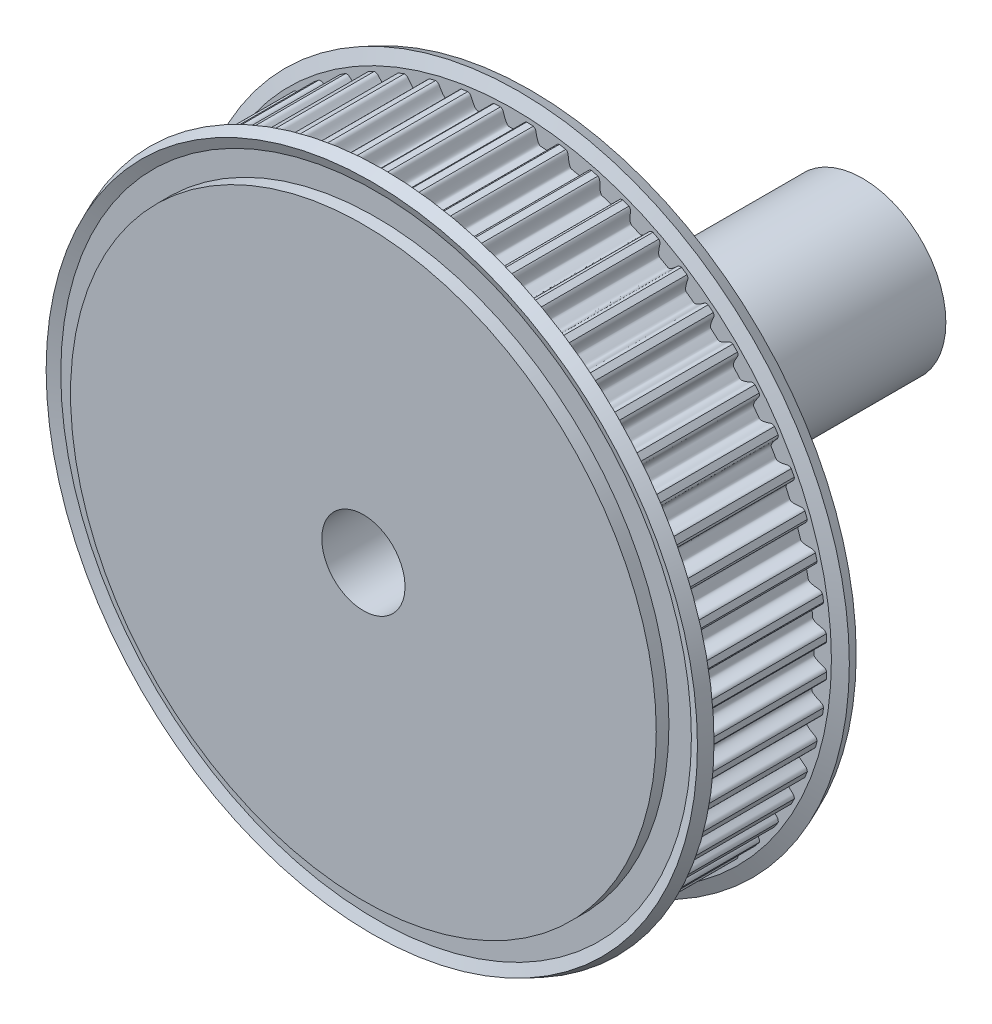
from build123d import *

# Parameters (mm, degrees)
TOOTHEXTRUDECUTGEARBELT01_DEPTH = 3.749999944
TOOTH_PATTERN_60_COUNT          = 60
BOREREVOLVESKETCH_W             = 10.547999842
BOREREVOLVESKETCH_H             = 5
SKETCH_5_R                      = 5
EXTRUDE_1_DEPTH                 = 10
SKETCH_6_R                      = 5
SKETCH_6_R_2                    = 2.5
EXTRUDE_2_DEPTH                 = 20
CUT_EXTRUDE_START               = -20
SKETCH_7_R                      = 2.5
CUT_EXTRUDE_2_DEPTH             = 20
CUT_EXTRUDE_3_DEPTH             = 20
SKETCH_9_R                      = 1.5
CUT_EXTRUDE_4_DEPTH             = 20


with BuildPart() as part:
    # SketchRevolveGearBelt01 → Gates_PowerGrip_GT_2mm, 6mm Belt Width (revolve)
    with BuildSketch(Plane(origin=(0, 0, 0), x_dir=(0, 0, -1), z_dir=(1, 0, 0))):
        Polygon((5.273999921, 0), (5.273999921, 17.598592907), (4.511999932, 17.598592907), (4.511999932, 18.947021663), (4.769626867, 19.568988102), (4.065630673, 19.860592873), (3.749999944, 19.098592884), (3.749999944, 18.829777068), (-3.749999944, 18.829777068), (-3.749999944, 19.098592884), (-4.065630673, 19.860592873), (-4.769626867, 19.568988102), (-4.511999932, 18.947021663), (-4.511999932, 17.598592907), (-5.273999921, 17.598592907), (-5.273999921, 0), align=None)
    revolve(axis=Axis((0, 0, 0), (0, 0, -1)))

    # SketchToothGearBelt01 → ToothExtrudeCutGearBelt01 (cut, symmetric)
    with BuildSketch(Plane.XY):
        with BuildLine():
            ThreePointArc((18.824561725, 0.8607569), (18.844230591, 0), (18.824561725, -0.8607569))
            add(Edge.make_bspline(
                [(18.824561725, -0.8607569), (18.824358755, -0.843647502), (18.821568238, -0.818014662), (18.813004371, -0.784841875), (18.80422062, -0.760694594), (18.79315697, -0.737503183), (18.779915938, -0.715482229), (18.764619985, -0.694835789), (18.747410971, -0.675754118), (18.72844716, -0.658416999), (18.70790789, -0.642973095), (18.685969056, -0.629609433), (18.662886778, -0.618285204), (18.620626894, -0.603332735), (18.567324654, -0.587252719), (18.504797108, -0.567481602), (18.45234798, -0.549825565), (18.403068335, -0.532186929), (18.356964182, -0.51454656), (18.314032963, -0.496909291), (18.274273916, -0.479273963), (18.237685437, -0.461640694), (18.204265617, -0.444008949), (18.174011962, -0.426377751), (18.146921446, -0.408745201), (18.122990241, -0.391107907), (18.102215048, -0.373460068), (18.084590975, -0.355792311), (18.070124482, -0.33809054), (18.058803716, -0.320336691), (18.050717843, -0.302512788), (18.04567708, -0.28461649), (18.043475836, -0.250312541), (18.046658102, -0.199994192), (18.046802157, -0.1333067), (18.04757069, -0.066656855), (18.047684762, 0), (18.04757069, 0.066656855), (18.046802157, 0.1333067), (18.046658102, 0.199994192), (18.043475836, 0.250312541), (18.04567708, 0.28461649), (18.050717843, 0.302512788), (18.058803716, 0.320336691), (18.070124482, 0.33809054), (18.084590975, 0.355792311), (18.102215048, 0.373460068), (18.122990241, 0.391107907), (18.146921446, 0.408745201), (18.174011962, 0.426377751), (18.204265617, 0.444008949), (18.237685437, 0.461640694), (18.274273916, 0.479273963), (18.314032963, 0.496909291), (18.356964182, 0.51454656), (18.403068335, 0.532186929), (18.45234798, 0.549825565), (18.504797108, 0.567481602), (18.567324654, 0.587252719), (18.620626894, 0.603332735), (18.662886778, 0.618285204), (18.685969056, 0.629609433), (18.70790789, 0.642973095), (18.72844716, 0.658416999), (18.747410971, 0.675754118), (18.764619985, 0.694835789), (18.779915938, 0.715482229), (18.79315697, 0.737503183), (18.80422062, 0.760694594), (18.813004371, 0.784841875), (18.821568238, 0.818014662), (18.824358755, 0.843647502), (18.824561725, 0.8607569)],
                knots=[0, 0, 0, 0, 0.019512813, 0.029269219, 0.039025625, 0.048782032, 0.058538438, 0.068294844, 0.078051251, 0.087807657, 0.097564063, 0.10732047, 0.117076876, 0.126833283, 0.158411348, 0.180601822, 0.201643681, 0.221544022, 0.240311236, 0.257955332, 0.274488358, 0.289924961, 0.304283149, 0.317585307, 0.329859599, 0.341141892, 0.351478382, 0.360929145, 0.369572747, 0.377511751, 0.384878211, 0.391836853, 0.398582347, 0.423955538, 0.449303692, 0.474651846, 0.5, 0.525348154, 0.550696308, 0.576044462, 0.601417653, 0.608163147, 0.615121789, 0.622488249, 0.630427253, 0.639070855, 0.648521618, 0.658858108, 0.670140401, 0.682414693, 0.695716851, 0.710075039, 0.725511642, 0.742044668, 0.759688764, 0.778455978, 0.798356319, 0.819398178, 0.841588652, 0.873166717, 0.882923124, 0.89267953, 0.902435937, 0.912192343, 0.921948749, 0.931705156, 0.941461562, 0.951217968, 0.960974375, 0.970730781, 0.980487187, 1, 1, 1, 1], degree=3))
        make_face()
    toothextrudecutgearbelt01 = extrude(amount=TOOTHEXTRUDECUTGEARBELT01_DEPTH, both=True, mode=Mode.SUBTRACT)

    # Tooth Pattern, 60: ToothExtrudeCutGearBelt01 ×60 about axis
    tooth_pattern_60_axis = Axis((0, 0, 55), (0, 0, -1))
    for i in range(1, TOOTH_PATTERN_60_COUNT):
        add(toothextrudecutgearbelt01.rotate(tooth_pattern_60_axis, i * 360 / TOOTH_PATTERN_60_COUNT), mode=Mode.SUBTRACT)

    # BoreRevolveSketch → BoreRevolveCut (revolve, cut)
    with BuildSketch(Plane(origin=(0, 0, 0), x_dir=(0, 0, -1), z_dir=(1, 0, 0))):
        with Locations((0, 2.5)):
            Rectangle(BOREREVOLVESKETCH_W, BOREREVOLVESKETCH_H)
    revolve(axis=Axis((0, 0, 0), (0, 0, -1)), mode=Mode.SUBTRACT)

    # 草图5 → 凸台-拉伸1 (add)
    with BuildSketch(Plane.XY.offset(5.273999921)):
        Circle(SKETCH_5_R)
    extrude(amount=-EXTRUDE_1_DEPTH)

    # 草图6 → 凸台-拉伸2 (add)
    with BuildSketch(Plane(origin=(0, 0, -4.726000079), x_dir=(-1, 0, 0), z_dir=(0, 0, -1))):
        Circle(SKETCH_6_R)
        Circle(SKETCH_6_R_2, mode=Mode.SUBTRACT)
    extrude(amount=EXTRUDE_2_DEPTH)

    # 草图7 → 切除-拉伸2 (cut)
    with BuildSketch(Plane(origin=(0, 0, -4.726000079), x_dir=(-1, 0, 0), z_dir=(0, 0, -1)).offset(CUT_EXTRUDE_START)):
        Circle(SKETCH_7_R)
    extrude(amount=CUT_EXTRUDE_2_DEPTH, mode=Mode.SUBTRACT)

    # 草图8 → 切除-拉伸3 (cut)
    with BuildSketch(Plane(origin=(0, 0, 0), x_dir=(1, 0, 0), z_dir=(0, 1, 0))):
        with BuildLine():
            ThreePointArc((0, 16.226000079), (-1.060660172, 13.665339907), (1.5, 14.726000079))
            ThreePointArc((1.5, 14.726000079), (1.060660172, 15.786660251), (0, 16.226000079))
        make_face()
    extrude(amount=-CUT_EXTRUDE_3_DEPTH, mode=Mode.SUBTRACT)

    # 草图9 → 切除-拉伸4 (cut)
    with BuildSketch(Plane(origin=(0, 0, 0), x_dir=(0, 0, -1), z_dir=(1, 0, 0))):
        with Locations((14.726000079, 0)):
            Circle(SKETCH_9_R)
    extrude(amount=-CUT_EXTRUDE_4_DEPTH, mode=Mode.SUBTRACT)


solid = part.part
